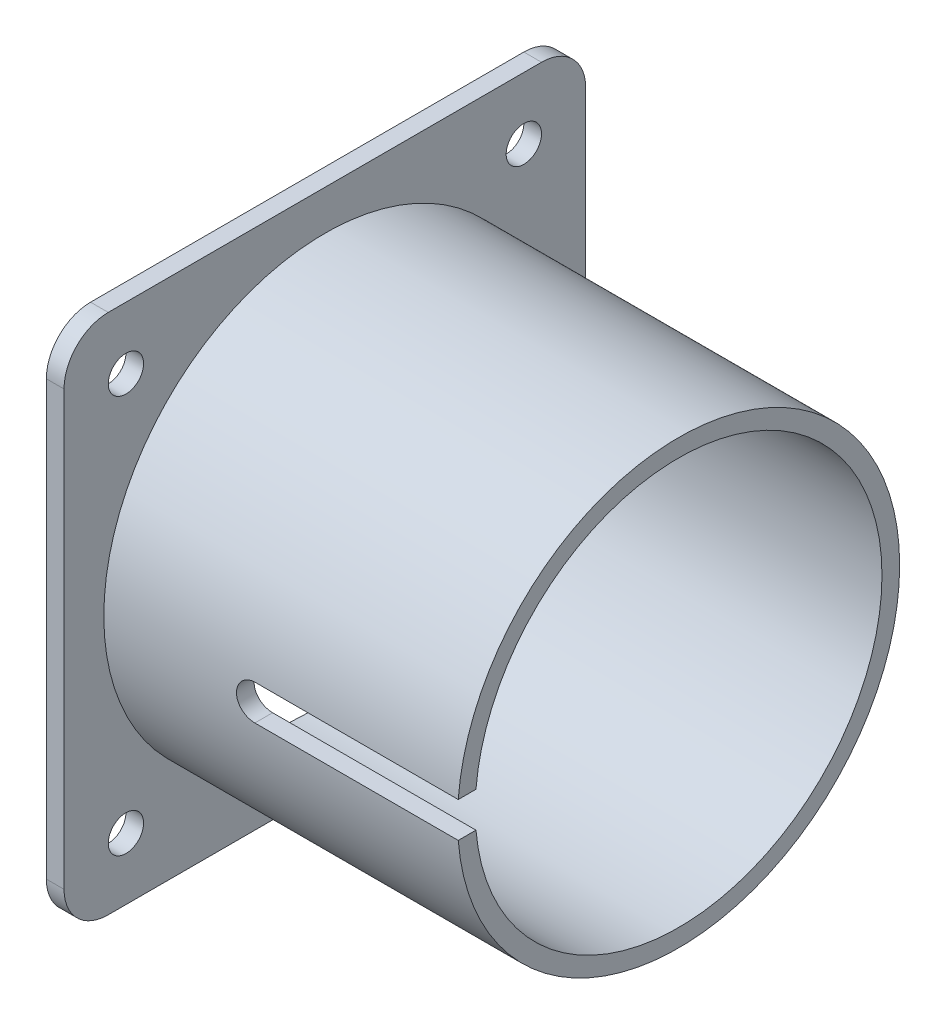
from build123d import *

# Parameters (mm, degrees)
CROQUIS1_R              = 4
CROQUIS1_R_2            = 46
SALIENTE_EXTRUIR1_DEPTH = 4
CROQUIS2_R              = 50
CROQUIS2_R_2            = 46
SALIENTE_EXTRUIR2_DEPTH = 80
CORTAR_EXTRUIR1_DEPTH   = 10
CROQUIS4_R              = 54
CROQUIS4_R_2            = 50
CORTAR_EXTRUIR2_DEPTH   = 3


with BuildPart() as part:
    # Croquis1 → Saliente-Extruir1 (new body)
    with BuildSketch(Plane(origin=(0, 0, 0), x_dir=(0, 0, -1), z_dir=(1, 0, 0))):
        with BuildLine():
            Line((49, 59), (-49, 59))
            ThreePointArc((-49, 59), (-56.071067812, 56.071067812), (-59, 49))
            Line((-59, 49), (-59, -49))
            ThreePointArc((-59, -49), (-56.071067812, -56.071067812), (-49, -59))
            Line((-49, -59), (49, -59))
            ThreePointArc((49, -59), (56.071067812, -56.071067812), (59, -49))
            Line((59, -49), (59, 49))
            ThreePointArc((59, 49), (56.071067812, 56.071067812), (49, 59))
        make_face()
        with Locations((-45, 45)):
            Circle(CROQUIS1_R, mode=Mode.SUBTRACT)
        Circle(CROQUIS1_R_2, mode=Mode.SUBTRACT)
        with Locations((-45, -45)):
            Circle(CROQUIS1_R, mode=Mode.SUBTRACT)
        with Locations((45, -45)):
            Circle(CROQUIS1_R, mode=Mode.SUBTRACT)
        with Locations((45, 45)):
            Circle(CROQUIS1_R, mode=Mode.SUBTRACT)
    extrude(amount=SALIENTE_EXTRUIR1_DEPTH)

    # Croquis2 → Saliente-Extruir2 (add)
    with BuildSketch(Plane(origin=(4, 0, 0), x_dir=(0, 0, -1), z_dir=(1, 0, 0))):
        Circle(CROQUIS2_R)
        Circle(CROQUIS2_R_2, mode=Mode.SUBTRACT)
    extrude(amount=SALIENTE_EXTRUIR2_DEPTH)

    # Croquis3 → Cortar-Extruir1 (cut)
    with BuildSketch(Plane.XY.offset(50)):
        with BuildLine():
            Line((84, 0), (84, 4))
            Line((84, 4), (38, 4))
            ThreePointArc((38, 4), (34, 0), (38, -4))
            Line((38, -4), (84, -4))
            Line((84, -4), (84, 0))
        make_face()
    extrude(amount=-CORTAR_EXTRUIR1_DEPTH, mode=Mode.SUBTRACT)

    # Croquis4 → Cortar-Extruir2 (cut)
    with BuildSketch(Plane.ZY):
        Circle(CROQUIS4_R)
        Circle(CROQUIS4_R_2, mode=Mode.SUBTRACT)
    extrude(amount=-CORTAR_EXTRUIR2_DEPTH, mode=Mode.SUBTRACT)


solid = part.part
